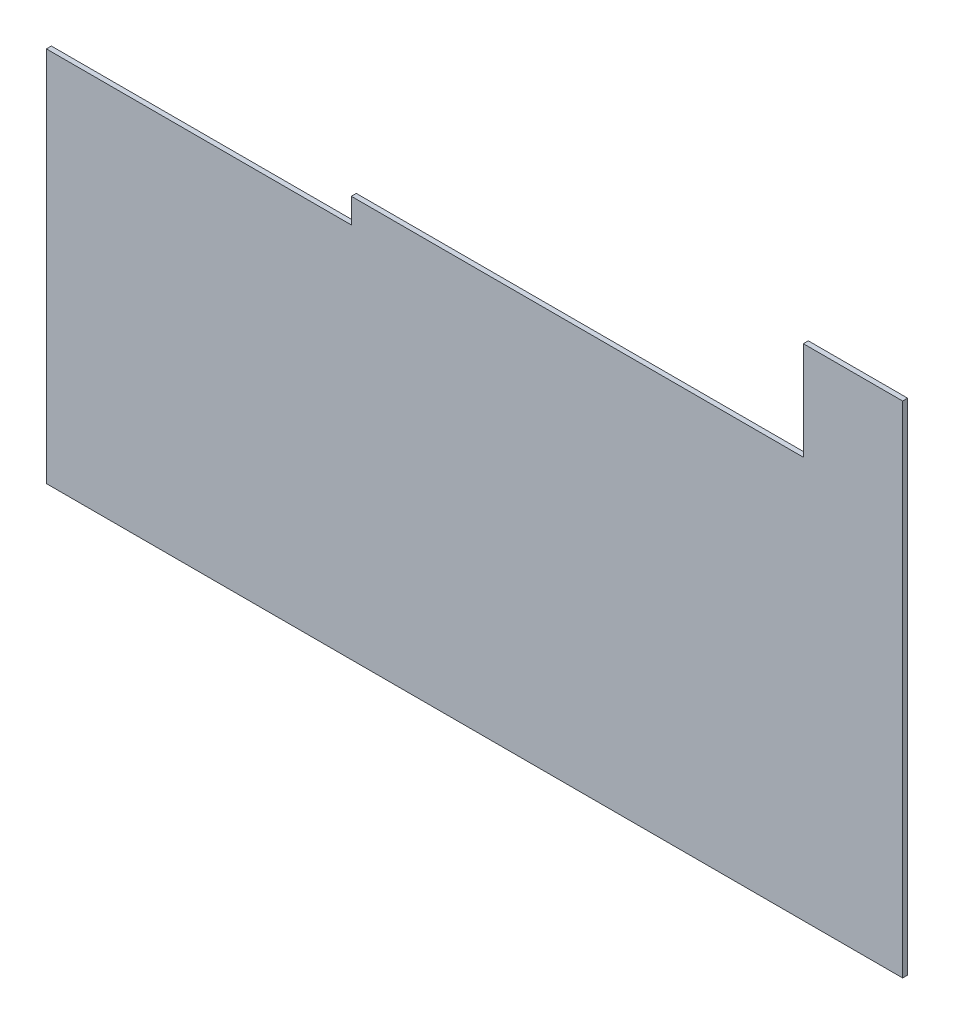
from build123d import *

# Parameters (mm, degrees)
TABAN_FLAN_1_DEPTH         = 25
KES_EKSTR_ZYON1_DEPTH      = 6508.676543898
KES_EKSTR_ZYON1_DEPTH_BACK = 6508.676543898
IZIM7_W                    = 1400
IZIM7_H                    = 1895
IZIM7_W_2                  = 310
IZIM7_H_2                  = 495
KES_EKSTR_ZYON2_DEPTH      = 6508.676543898
KES_EKSTR_ZYON2_DEPTH_BACK = 6508.676543898
IZIM8_W                    = 292
IZIM8_H                    = 2515


# Sheet-metal steps are written as plain solids
with BuildPart() as part:
    # Çizim1 → Taban-Flanş1 (new body)
    with BuildSketch(Plane.XY):
        Polygon((0, 0), (0, 1895), (2935, 1895), (2935, 2020), (4900, 2020), (4900, 2515), (6002, 2515), (6002, 0), align=None)
    extrude(amount=-TABAN_FLAN_1_DEPTH)

    # Çizim7 → Kes-Ekstrüzyon1 (cut, two sides: drawn at the far end of the back side and taken through both)
    with BuildSketch(Plane.XY.offset(-KES_EKSTR_ZYON1_DEPTH_BACK)):
        with Locations((700, 947.5)):
            Rectangle(IZIM7_W, IZIM7_H)
        with Locations((5055, 2267.5)):
            Rectangle(IZIM7_W_2, IZIM7_H_2)
    extrude(amount=KES_EKSTR_ZYON1_DEPTH + KES_EKSTR_ZYON1_DEPTH_BACK, mode=Mode.SUBTRACT)

    # Çizim8 → Kes-Ekstrüzyon2 (cut, two sides: drawn at the far end of the back side and taken through both)
    with BuildSketch(Plane.XY.offset(-KES_EKSTR_ZYON2_DEPTH_BACK)):
        with Locations((5856, 1257.5)):
            Rectangle(IZIM8_W, IZIM8_H)
    extrude(amount=KES_EKSTR_ZYON2_DEPTH + KES_EKSTR_ZYON2_DEPTH_BACK, mode=Mode.SUBTRACT)


solid = part.part
